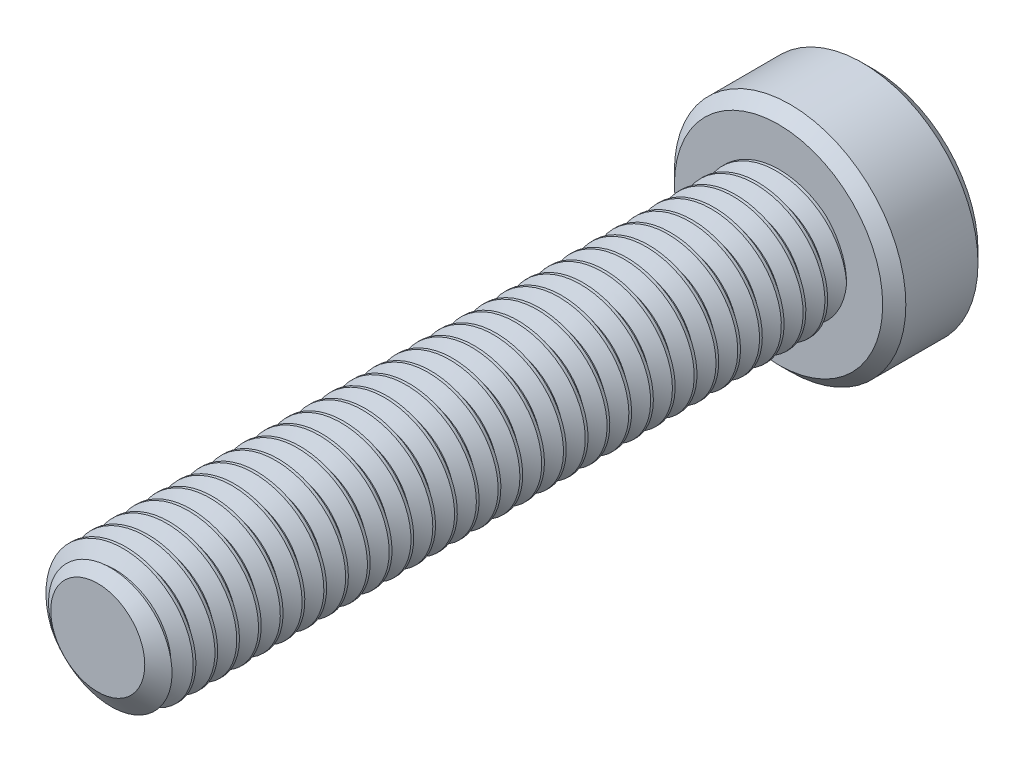
from build123d import *

# Parameters (mm, degrees)
SKETCH1_R          = 2.5
EXTRUDE1_DEPTH     = 25
CUT_SWEEP1_PITCH   = 0.8
SKETCH6_R          = 4.25
EXTRUDE2_DEPTH     = 3.5
CUT_EXTRUDE1_DEPTH = 2.25
CHAMFER1_SIZE      = 0.425


with BuildPart() as part:
    # Sketch1 → Extrude1 (new body)
    with BuildSketch(Plane.XY):
        Circle(SKETCH1_R)
    extrude(amount=-EXTRUDE1_DEPTH)

    # Cut-Sweep1: the profile of Sketch3 profile screwed along a right-hand helix of 32.25 turns, 6 arcs to a turn; built about Z, then put on its axis
    cut_sweep1_z = Axis((0, 0, 0), (0, 0, 1))
    cut_sweep1_corners = [(2.5003, 0, -0.700173205), (1.980384758, 0, -0.4), (1.980384758, 0, -0.3), (2.5003, 0, 0.000173205)]
    with BuildLine(mode=Mode.PRIVATE) as cut_sweep1_profile:
        Line(cut_sweep1_corners[0], cut_sweep1_corners[1])
        Line(cut_sweep1_corners[1], cut_sweep1_corners[2])
        Line(cut_sweep1_corners[2], cut_sweep1_corners[3])
        Line(cut_sweep1_corners[3], cut_sweep1_corners[0])
    cut_sweep1_cap = Face(cut_sweep1_profile.wire())
    cut_sweep1_turn_angles = [0, 30, 60, 90, 120, 150, 180, 210, 240, 270, 300, 330, 360]
    cut_sweep1_turn_weights = [1, 0.8660254037844387, 1, 0.8660254037844387, 1, 0.8660254037844387, 1, 0.8660254037844387, 1, 0.8660254037844387, 1, 0.8660254037844387, 1]
    cut_sweep1_turn_rails = [Edge.make_bspline([Vector(p[0], p[1], 0).rotate(cut_sweep1_z, cut_sweep1_turn_angles[k]) / cut_sweep1_turn_weights[k] + Vector(0, 0, p[2] + CUT_SWEEP1_PITCH * cut_sweep1_turn_angles[k] / 360) for k in range(13)], [0, 0, 0, 1, 1, 2, 2, 3, 3, 4, 4, 5, 5, 6, 6, 6], 2, cut_sweep1_turn_weights) for p in cut_sweep1_corners]
    cut_sweep1_turn_sides = [Face.make_surface_from_curves(cut_sweep1_turn_rails[p[0]], cut_sweep1_turn_rails[p[1]]) for p in [(0, 1), (1, 2), (2, 3), (3, 0)]]
    cut_sweep1_last_angles = [11520, 11550, 11580, 11595, 11610]
    cut_sweep1_last_weights = [1, 0.8660254037844387, 1, 0.9659258262891915, 1]
    cut_sweep1_last_rails = [Edge.make_bspline([Vector(p[0], p[1], 0).rotate(cut_sweep1_z, cut_sweep1_last_angles[k]) / cut_sweep1_last_weights[k] + Vector(0, 0, p[2] + CUT_SWEEP1_PITCH * cut_sweep1_last_angles[k] / 360) for k in range(5)], [0, 0, 0, 1, 1, 2, 2, 2], 2, cut_sweep1_last_weights) for p in cut_sweep1_corners]
    cut_sweep1_last_sides = [Face.make_surface_from_curves(cut_sweep1_last_rails[p[0]], cut_sweep1_last_rails[p[1]]) for p in [(0, 1), (1, 2), (2, 3), (3, 0)]]
    cut_sweep1 = Plane(origin=(0, 0, 0), x_dir=(0, 1, 0), z_dir=(0, 0, -1)) * Solid(Shell([*[p.moved(Location((0, 0, CUT_SWEEP1_PITCH * i))) for i in range(32) for p in cut_sweep1_turn_sides], *cut_sweep1_last_sides, cut_sweep1_cap, cut_sweep1_cap.rotate(cut_sweep1_z, 11610).moved(Location((0, 0, CUT_SWEEP1_PITCH * 11610 / 360)))]))
    add(cut_sweep1, mode=Mode.SUBTRACT)

    # Sketch4 → Cut-Revolve1 (revolve, cut)
    with BuildSketch(Plane(origin=(0, 0, 0), x_dir=(0, 0, -1), z_dir=(1, 0, 0)), mode=Mode.PRIVATE) as cut_revolve1_sk:
        Polygon((0.541691224, 2.5), (0, 1.726384758), (0, 2.5), align=None)
    revolve(cut_revolve1_sk.sketch.rotate(Axis((0, 0, 0), (0, 0, -1)), 260.43858876), axis=Axis((0, 0, 0), (0, 0, -1)), mode=Mode.SUBTRACT)

    # Sketch6 → Extrude2 (add)
    with BuildSketch(Plane(origin=(0, 0, -25), x_dir=(-1, 0, 0), z_dir=(0, 0, -1))):
        Circle(SKETCH6_R)
    extrude(amount=EXTRUDE2_DEPTH)

    # Sketch7 → Cut-Extrude1 (cut)
    with BuildSketch(Plane(origin=(0, 0, -28.5), x_dir=(-1, 0, 0), z_dir=(0, 0, -1))):
        Polygon((0, 1.732050808), (-1.5, 0.866025404), (-1.5, -0.866025404), (0, -1.732050808), (1.5, -0.866025404), (1.5, 0.866025404), align=None)
    extrude(amount=-CUT_EXTRUDE1_DEPTH, mode=Mode.SUBTRACT)

    # Cut-Extrude2 cone 1 section (through the dimple's axis) → Cut-Extrude2 (revolve, cut)
    with BuildSketch(Plane(origin=(0, 0, -28.5), x_dir=(0, 1, 0), z_dir=(1, 0, 0))):
        Polygon((0, 0), (1.732050808, 0), (0, 1.732050808), align=None)
    revolve(axis=Axis((0, 0, -28.5), (0, 0, 1)), mode=Mode.SUBTRACT)

    # Chamfer1
    chamfer1_edges = [part.edges().sort_by_distance(p)[0] for p in [
        (4.25, 0, -25),
        (4.25, 0, -28.5),
    ]]
    chamfer(chamfer1_edges, length=CHAMFER1_SIZE)


solid = part.part
